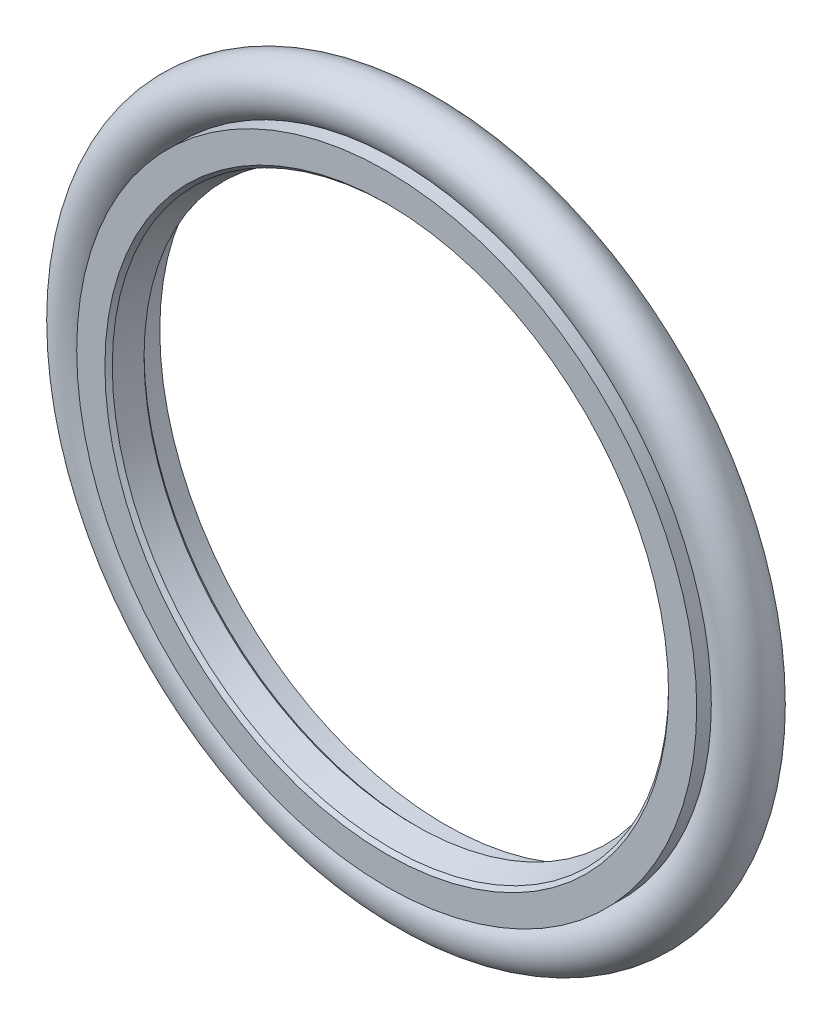
from build123d import *

# Parameters (mm, degrees)
SKETCH4_R = 1.765


with BuildPart() as part:
    # Sketch1 → Revolve1 (revolve)
    with BuildSketch(Plane(origin=(0, 0, 0), x_dir=(0, 0, -1), z_dir=(1, 0, 0))):
        with BuildLine():
            Line((0, 19.25), (0, 20.9))
            Line((0, 20.9), (-3.95, 20.9))
            Line((-3.95, 20.9), (-3.95, 19))
            Line((-3.95, 19), (-3.7, 18.751398318))
            Line((-3.7, 18.751398318), (-2.06, 18.25))
            Line((-2.06, 18.25), (-1.81, 18.5))
            Line((-1.81, 18.5), (-1.81, 19))
            ThreePointArc((-1.81, 19), (-1.736776695, 19.176776695), (-1.56, 19.25))
            Line((-1.56, 19.25), (0, 19.25))
        make_face()
    revolve(axis=Axis((0, 0, 0), (0, 0, 1)))


with BuildPart() as body_2:
    # Sketch4 → Revolve2 (revolve)
    with BuildSketch(Plane(origin=(0, 0, 0), x_dir=(0, 0, -1), z_dir=(1, 0, 0))):
        with Locations((-1.975, 22.405)):
            Circle(SKETCH4_R)
    revolve(axis=Axis((0, 0, 0), (0, 0, 1)))


solid = Compound([part.part, body_2.part])
